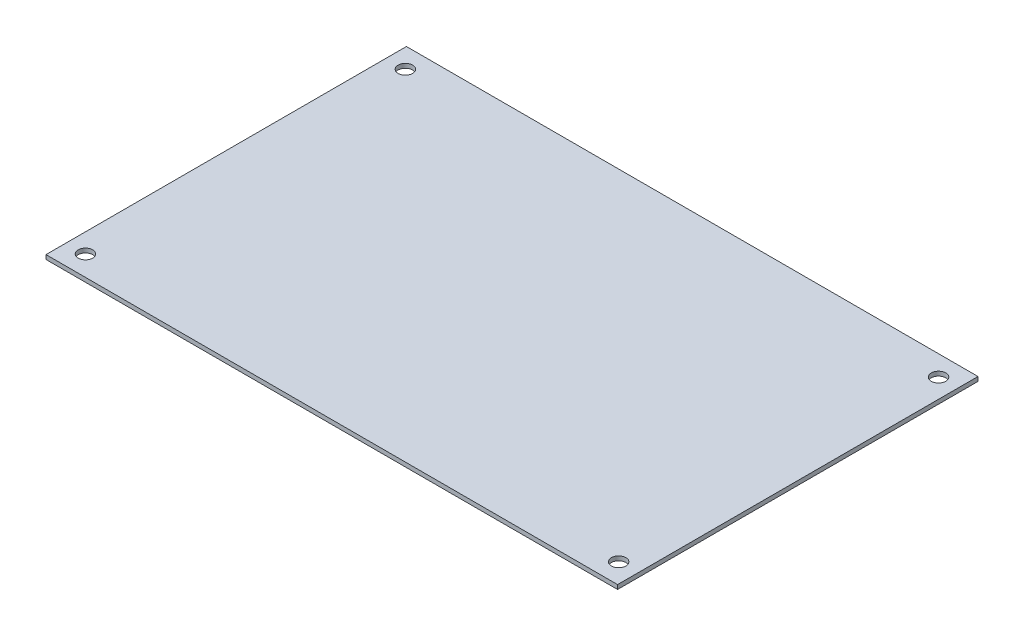
from build123d import *

# Parameters (mm, degrees)
SKETCH1_W                = 134
SKETCH1_H                = 84.5
BOSS_EXTRUDE1_DEPTH      = 1
M3_CLEARANCE_HOLE1_D     = 3.4
M3_CLEARANCE_HOLE1_DEPTH = 5
M3_CLEARANCE_HOLE1_TIP   = 1.021463052


with BuildPart() as part:
    # Sketch1 → Boss-Extrude1 (new body)
    with BuildSketch(Plane(origin=(0, 0, 0), x_dir=(1, 0, 0), z_dir=(0, 1, 0))):
        with Locations((67, 42.25)):
            Rectangle(SKETCH1_W, SKETCH1_H)
    extrude(amount=BOSS_EXTRUDE1_DEPTH)

    # M3 Clearance Hole1
    with Locations(Plane(origin=(0, 1, 0), x_dir=(1, 0, 0), z_dir=(0, 1, 0))):
        with Locations((4.5, 79.75), (129.5, 79.75), (129.5, 4.75), (4.5, 4.75)):
            Hole(M3_CLEARANCE_HOLE1_D / 2, depth=M3_CLEARANCE_HOLE1_DEPTH)
            with Locations((0, 0, -(M3_CLEARANCE_HOLE1_DEPTH + M3_CLEARANCE_HOLE1_TIP / 2))):  # 118° drill point
                Cone(0, M3_CLEARANCE_HOLE1_D / 2, M3_CLEARANCE_HOLE1_TIP, mode=Mode.SUBTRACT)


solid = part.part
